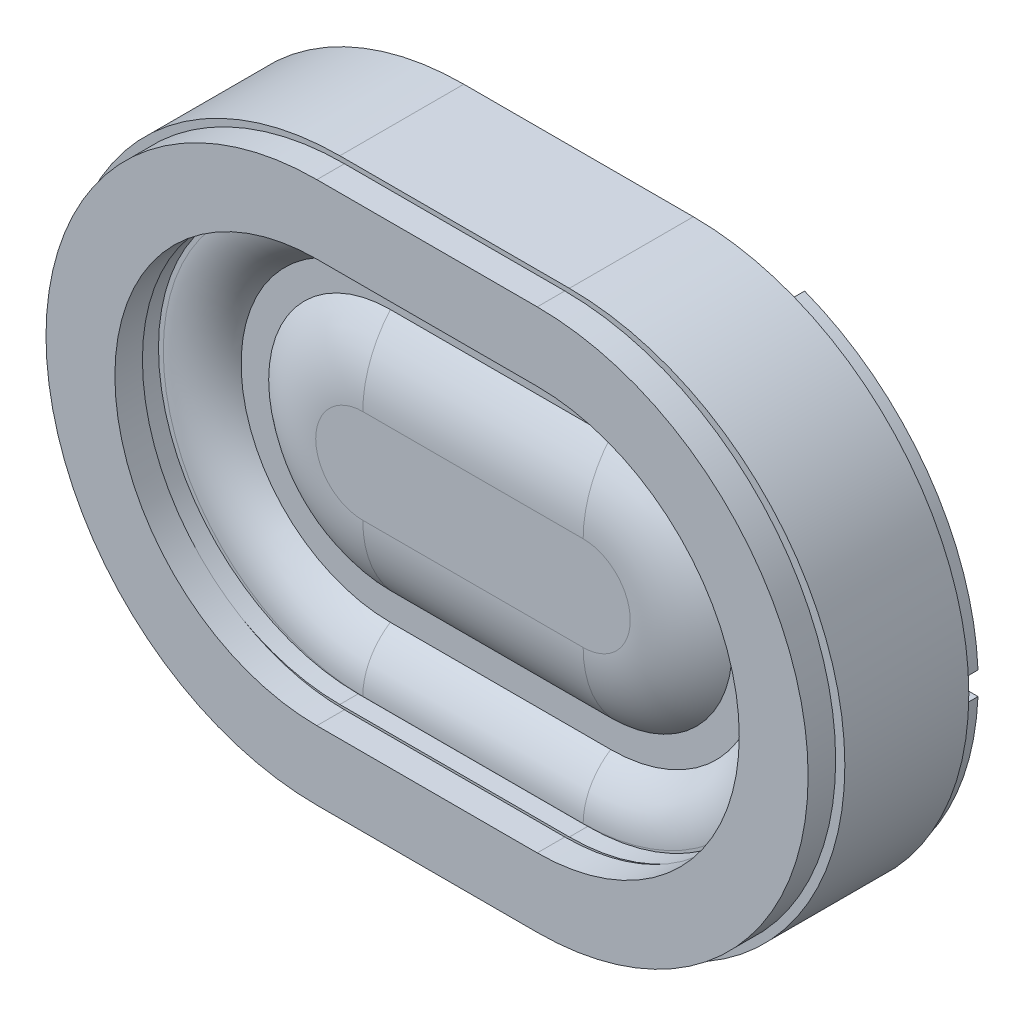
from build123d import *

# Parameters (mm, degrees)
EXTRUDE_1_DEPTH     = 1
EXTRUDE_2_DEPTH     = 2.7
EXTRUDE_1_2_DEPTH   = 0.6
CUT_EXTRUDE_1_DEPTH = 1
CUT_EXTRUDE_2_DEPTH = 0.4
FILLET_1_R          = 1.3
FILLET_2_R          = 2.5
EXTRUDE_START       = -0.3
EXTRUDE_3_DEPTH     = 0.3


with BuildPart() as part:
    # Эскиз1 → Extrude 1 (new body)
    with BuildSketch(Plane.XY):
        with BuildLine():
            Line((-2.4, 4.3), (2.4, 4.3))
            ThreePointArc((2.4, 4.3), (6.7, 0), (2.4, -4.3))
            Line((2.4, -4.3), (-2.4, -4.3))
            ThreePointArc((-2.4, -4.3), (-6.7, 0), (-2.4, 4.3))
        make_face()
    extrude(amount=EXTRUDE_1_DEPTH)

    # Эскиз2 → Бобышка-Вытянуть2 (add)
    with BuildSketch(Plane.XY.offset(1)):
        with BuildLine():
            Line((-2.5, 6), (2.5, 6))
            ThreePointArc((2.5, 6), (8.5, 0), (2.5, -6))
            Line((2.5, -6), (-2.5, -6))
            ThreePointArc((-2.5, -6), (-8.5, 0), (-2.5, 6))
        make_face()
    extrude(amount=EXTRUDE_2_DEPTH)

    # Эскиз3 → Extrude 1 2 (add)
    with BuildSketch(Plane.XY.offset(3.7)):
        with BuildLine():
            Line((2.4, -5.9), (-2.4, -5.9))
            ThreePointArc((-2.4, -5.9), (-8.3, 0), (-2.4, 5.9))
            Line((-2.4, 5.9), (2.4, 5.9))
            ThreePointArc((2.4, 5.9), (8.3, 0), (2.4, -5.9))
        make_face()
        with BuildLine():
            Line((2.4, -4.4), (-2.4, -4.4))
            ThreePointArc((-2.4, -4.4), (-6.8, 0), (-2.4, 4.4))
            Line((-2.4, 4.4), (2.4, 4.4))
            ThreePointArc((2.4, 4.4), (6.8, 0), (2.4, -4.4))
        make_face(mode=Mode.SUBTRACT)
    extrude(amount=EXTRUDE_1_2_DEPTH)

    # Эскиз4 → Вырез-Вытянуть1 (cut)
    with BuildSketch(Plane.XY.offset(3.7)):
        with BuildLine():
            Line((-2.4, 3.25), (2.4, 3.25))
            ThreePointArc((2.4, 3.25), (5.65, 0), (2.4, -3.25))
            Line((2.4, -3.25), (-2.4, -3.25))
            ThreePointArc((-2.4, -3.25), (-5.65, 0), (-2.4, 3.25))
        make_face()
        with BuildLine():
            Line((2.4, -2.65), (-2.4, -2.65))
            ThreePointArc((-2.4, -2.65), (-5.05, 0), (-2.4, 2.65))
            Line((-2.4, 2.65), (2.4, 2.65))
            ThreePointArc((2.4, 2.65), (5.05, 0), (2.4, -2.65))
        make_face(mode=Mode.SUBTRACT)
    extrude(amount=-CUT_EXTRUDE_1_DEPTH, mode=Mode.SUBTRACT)

    # Эскиз5 → Вырез-Вытянуть2 (cut)
    with BuildSketch(Plane.XY.offset(3.7)):
        with BuildLine():
            Line((2.5, -4.35), (-2.5, -4.35))
            ThreePointArc((-2.5, -4.35), (-6.85, 0), (-2.5, 4.35))
            Line((-2.5, 4.35), (2.5, 4.35))
            ThreePointArc((2.5, 4.35), (6.85, 0), (2.5, -4.35))
        make_face()
    extrude(amount=-CUT_EXTRUDE_2_DEPTH, mode=Mode.SUBTRACT)

    # Скругление1
    # the kernel refuses this fillet: 1.3 mm, written as the material it takes off along each edge
    with BuildSketch(Plane(origin=(2.4, 0, 3.3), x_dir=(0, -1, 0), z_dir=(-1, 0, 0))) as fillet_1_piece_1:
        with BuildLine():
            CenterArc((4.345445115, -1.3), FILLET_1_R, 90, 57.421029607)
            Line((3.25, -0.6), (3.25, 0))
            Line((3.25, 0), (4.345445115, 0))
        make_face()
    revolve(axis=Axis((2.4, 0, 3.3), (0, 0, 1)), revolution_arc=180, mode=Mode.SUBTRACT)
    with BuildSketch(Plane(origin=(-2.4, 3.25, 3.3), x_dir=(0, 1, 0), z_dir=(1, 0, 0)), Plane(origin=(2.4, -3.25, 3.3), x_dir=(0, -1, 0), z_dir=(-1, 0, 0))) as fillet_1_piece_2:
        with BuildLine():
            CenterArc((1.095445115, -1.3), FILLET_1_R, 90, 57.421029607)
            Line((0, -0.6), (0, 0))
            Line((0, 0), (1.095445115, 0))
        make_face()
    extrude(amount=4.8, mode=Mode.SUBTRACT)
    with BuildSketch(Plane(origin=(-2.4, 0, 3.3), x_dir=(0, 1, 0), z_dir=(1, 0, 0))) as fillet_1_piece_3:
        with BuildLine():
            CenterArc((4.345445115, -1.3), FILLET_1_R, 90, 57.421029607)
            Line((3.25, -0.6), (3.25, 0))
            Line((3.25, 0), (4.345445115, 0))
        make_face()
    revolve(axis=Axis((-2.4, 0, 3.3), (0, 0, 1)), revolution_arc=180, mode=Mode.SUBTRACT)

    # Скругление2
    # the kernel refuses this fillet: 2.5 mm, written as the material it takes off along each edge
    with BuildSketch(Plane(origin=(2.4, 0, 3.3), x_dir=(0, -1, 0), z_dir=(-1, 0, 0))) as fillet_2_piece_1:
        with BuildLine():
            CenterArc((1.025192319, -2.5), FILLET_2_R, 49.464197889, 40.535802111)
            Line((1.025192319, 0), (1.025192319, 0.05))
            Line((1.025192319, 0.05), (2.65, 0.05))
            Line((2.65, 0.05), (2.7, 0))
            ThreePointArc((2.7, 0), (2.7, -0.3), (2.682496154, -0.562))
            Line((2.682496154, -0.562), (2.65, -0.6))
        make_face()
    revolve(axis=Axis((2.4, 0, 3.3), (0, 0, 1)), revolution_arc=180, mode=Mode.SUBTRACT)
    with BuildSketch(Plane(origin=(-2.4, 2.65, 3.3), x_dir=(0, 0, -1), z_dir=(1, 0, 0)), Plane(origin=(2.4, -2.65, 3.3), x_dir=(0, 0, -1), z_dir=(-1, 0, 0))) as fillet_2_piece_2:
        with BuildLine():
            CenterArc((2.5, -1.624807681), FILLET_2_R, 139.464197889, 40.535802111)
            Line((0, -1.624807681), (-0.05, -1.624807681))
            Line((-0.05, -1.624807681), (-0.05, 0))
            Line((-0.05, 0), (0, 0.05))
            ThreePointArc((0, 0.05), (0.3, 0.05), (0.562, 0.032496154))
            Line((0.562, 0.032496154), (0.6, 0))
        make_face()
    extrude(amount=4.8, mode=Mode.SUBTRACT)
    with BuildSketch(Plane(origin=(-2.4, 0, 3.3), x_dir=(0, 1, 0), z_dir=(1, 0, 0))) as fillet_2_piece_3:
        with BuildLine():
            CenterArc((1.025192319, -2.5), FILLET_2_R, 49.464197889, 40.535802111)
            Line((1.025192319, 0), (1.025192319, 0.05))
            Line((1.025192319, 0.05), (2.65, 0.05))
            Line((2.65, 0.05), (2.7, 0))
            ThreePointArc((2.7, 0), (2.7, -0.3), (2.682496154, -0.562))
            Line((2.682496154, -0.562), (2.65, -0.6))
        make_face()
    revolve(axis=Axis((-2.4, 0, 3.3), (0, 0, 1)), revolution_arc=180, mode=Mode.SUBTRACT)

    # Эскиз6 → Бобышка-Вытянуть3 (add)
    with BuildSketch(Plane.XY.offset(1).offset(EXTRUDE_START)):
        with BuildLine():
            Line((6.692726406, 0.25), (8.40002281, 0.25))
            ThreePointArc((8.40002281, 0.25), (7.297123742, 3.443889221), (4.623650475, 5.510252065))
            Line((4.623650475, 5.510252065), (3.490230582, 4.159494835))
            ThreePointArc((3.490230582, 4.159494835), (5.726423597, 2.72486808), (6.692726406, 0.25))
        make_face()
        with BuildLine():
            Line((6.692726406, -0.25), (8.40002281, -0.25))
            ThreePointArc((8.40002281, -0.25), (7.297123742, -3.443889221), (4.623650475, -5.510252065))
            Line((4.623650475, -5.510252065), (3.490230582, -4.159494835))
            ThreePointArc((3.490230582, -4.159494835), (5.726423597, -2.72486808), (6.692726406, -0.25))
        make_face()
    extrude(amount=EXTRUDE_3_DEPTH)


solid = part.part
